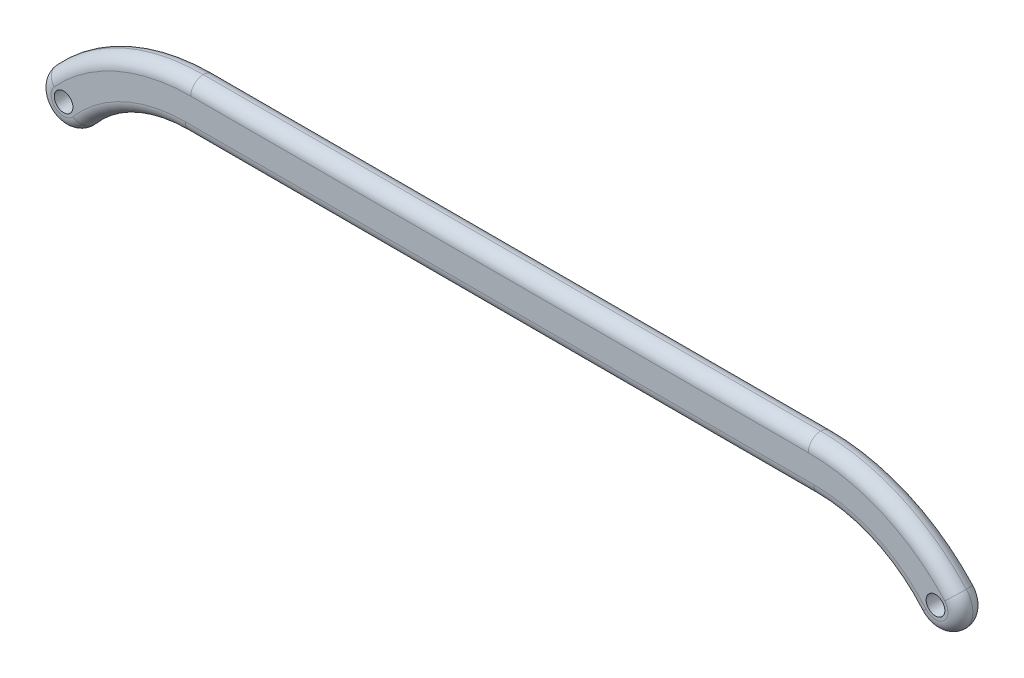
from build123d import *

# Parameters (mm, degrees)
SKETCH1_R           = 1.5
BOSS_EXTRUDE1_DEPTH = 4
FILLET1_R           = 2


with BuildPart() as part:
    # Sketch1 → Boss-Extrude1 (new body)
    with BuildSketch(Plane.XY):
        with BuildLine():
            Line((20.430139316, 13), (119.569860684, 13))
            ThreePointArc((119.569860684, 13), (132.344758657, 10.310849901), (142.951440202, 2.699814945))
            ThreePointArc((142.951440202, 2.699814945), (142.64957914, -2.996619826), (136.959055493, -2.598587405))
            ThreePointArc((136.959055493, -2.598587405), (129.548246583, 3.008962434), (120.470775938, 5))
            Line((120.470775938, 5), (19.529224062, 5))
            ThreePointArc((19.529224062, 5), (10.451753417, 3.008962434), (3.040944507, -2.598587405))
            ThreePointArc((3.040944507, -2.598587405), (-2.64957914, -2.996619826), (-2.951440202, 2.699814945))
            ThreePointArc((-2.951440202, 2.699814945), (7.655241343, 10.310849901), (20.430139316, 13))
        make_face()
        Circle(SKETCH1_R, mode=Mode.SUBTRACT)
        with Locations(Location((140, 0, 0), (0, 0, 180))):
            Circle(SKETCH1_R, mode=Mode.SUBTRACT)
    extrude(amount=BOSS_EXTRUDE1_DEPTH)

    # Fillet1
    fillet1_edges = [part.edges().sort_by_distance(p)[0] for p in [
        (10.451753417, 3.008962434, 4),
        (-2.64957914, -2.996619826, 4),
        (7.655241343, 10.310849901, 4),
        (70, 13, 4),
        (132.344758657, 10.310849901, 4),
        (142.64957914, -2.996619826, 4),
        (129.548246583, 3.008962434, 4),
        (10.451753417, 3.008962434, 0),
        (-2.64957914, -2.996619826, 0),
        (7.655241343, 10.310849901, 0),
        (70, 13, 0),
        (132.344758657, 10.310849901, 0),
        (142.64957914, -2.996619826, 0),
        (129.548246583, 3.008962434, 0),
        (70, 5, 4),
        (70, 5, 0),
    ]]
    fillet(fillet1_edges, radius=FILLET1_R - 0.0001)  # a hair under: the kernel refuses the full size


solid = part.part
